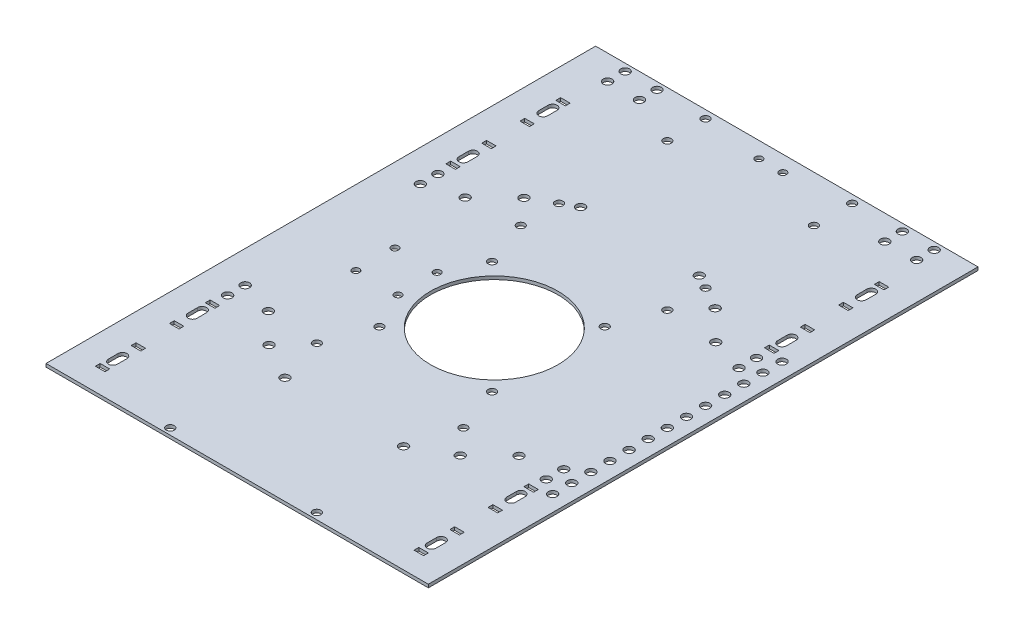
from build123d import *

# Parameters (mm, degrees)
SM_BASE_FLANGE_1_DEPTH   = 2
SKETCH_6_R               = 2.75
CUT_EXTRUDE_1_DEPTH      = 10
SKETCH_7_R               = 2.5
SKETCH_7_R_2             = 40
CUT_EXTRUDE_2_DEPTH      = 10
SKETCH_9_W               = 240
SKETCH_9_H               = 20
EXTRUDE_1_DEPTH          = 2
SKETCH_8_R               = 2.75
SKETCH_8_W               = 6
SKETCH_8_H               = 3
CUT_EXTRUDE_3_DEPTH      = 10
MIRROR_2_COPY_1_SKETCH_R = 2.75
MIRROR_2_COPY_1_SKETCH_W = 6
MIRROR_2_COPY_1_SKETCH_H = 3
MIRROR_2_COPY_1_DEPTH    = 10
SKETCH_10_R              = 2.75
CUT_EXTRUDE_4_DEPTH      = 10
SKETCH_11_R              = 2.75
CUT_EXTRUDE_5_DEPTH      = 10
SKETCH_12_R              = 2.25
CUT_EXTRUDE_6_DEPTH      = 10
SKETCH_13_R              = 2.5
CUT_EXTRUDE_7_DEPTH      = 3
SKETCH_14_R              = 2.5
CUT_EXTRUDE_8_DEPTH      = 10


# Sheet-metal steps are written as plain solids
with BuildPart() as part:
    # Sketch 1 → 基体-法兰1 (new body)
    with BuildSketch(Plane(origin=(0, 0, 0), x_dir=(1, 0, 0), z_dir=(0, 1, 0))):
        Polygon((-120, 140), (-120, -140), (120, -140), (120, 140), (120, 185), (-120, 185), align=None)
    extrude(amount=-SM_BASE_FLANGE_1_DEPTH)

    # 草图6 → 切除-拉伸1 (cut)
    with BuildSketch(Plane(origin=(0, 0, 0), x_dir=(1, 0, 0), z_dir=(0, 1, 0))):
        with Locations(Location((-60, -80, 0), (0, 0, 270))):
            Circle(SKETCH_6_R)
        with Locations(Location((-78.661073186, -61.744923397, 0), (0, 0, 270))):
            Circle(SKETCH_6_R)
        with Locations(Location((-37.250025969, -92.803208809, 0), (0, 0, 270))):
            Circle(SKETCH_6_R)
        with Locations(Location((37.250025969, -92.803208809, 0), (0, 0, 270))):
            Circle(SKETCH_6_R)
        with Locations(Location((78.661073186, -61.744923397, 0), (0, 0, 270))):
            Circle(SKETCH_6_R)
        with Locations(Location((60, -80, 0), (0, 0, 270))):
            Circle(SKETCH_6_R)
        with Locations(Location((78.661073186, 61.744923397, 0), (0, 0, 270))):
            Circle(SKETCH_6_R)
        with Locations(Location((37.250025969, 92.803208809, 0), (0, 0, 270))):
            Circle(SKETCH_6_R)
        with Locations(Location((-60, 80, 0), (0, 0, 270))):
            Circle(SKETCH_6_R)
        with Locations(Location((60, 80, 0), (0, 0, 270))):
            Circle(SKETCH_6_R)
        with Locations(Location((-78.661073186, 61.744923397, 0), (0, 0, 270))):
            Circle(SKETCH_6_R)
        with Locations(Location((-37.250025969, 92.803208809, 0), (0, 0, 270))):
            Circle(SKETCH_6_R)
    extrude(amount=-CUT_EXTRUDE_1_DEPTH, mode=Mode.SUBTRACT)

    # 草图7 → 切除-拉伸2 (cut)
    with BuildSketch(Plane(origin=(0, 0, 0), x_dir=(1, 0, 0), z_dir=(0, 1, 0))):
        with Locations(Location((-35.355339059, 35.355339059, 0), (0, 0, 270))):
            Circle(SKETCH_7_R)
        with Locations(Location((35.355339059, 35.355339059, 0), (0, 0, 270))):
            Circle(SKETCH_7_R)
        with Locations(Location((35.355339059, -35.355339059, 0), (0, 0, 270))):
            Circle(SKETCH_7_R)
        with Locations(Location((-35.355339059, -35.355339059, 0), (0, 0, 270))):
            Circle(SKETCH_7_R)
        with Locations(Location((1.384475496, 0, 0), (0, 0, 270))):
            Circle(SKETCH_7_R_2)
    extrude(amount=-CUT_EXTRUDE_2_DEPTH, mode=Mode.SUBTRACT)

    # 草图9 → 凸台-拉伸1 (add)
    with BuildSketch(Plane(origin=(0, 0, 0), x_dir=(1, 0, 0), z_dir=(0, 1, 0))):
        with Locations((0, -150)):
            Rectangle(SKETCH_9_W, SKETCH_9_H)
    extrude(amount=-EXTRUDE_1_DEPTH)

    # 草图8 → 切除-拉伸3 (cut)
    with BuildSketch(Plane(origin=(0, 0, 0), x_dir=(1, 0, 0), z_dir=(0, 1, 0))):
        with Locations(Location((100, -66, 0), (0, 0, 270))):
            Circle(SKETCH_8_R)
        with Locations(Location((100, -55, 0), (0, 0, 270))):
            Circle(SKETCH_8_R)
        with BuildLine():
            Line((102.8, -132), (102.8, -138))
            ThreePointArc((102.8, -138), (100, -140.8), (97.2, -138))
            Line((97.2, -138), (97.2, -132))
            ThreePointArc((97.2, -132), (100, -129.2), (102.8, -132))
        make_face()
        with Locations((100, -144.5)):
            Rectangle(SKETCH_8_W, SKETCH_8_H)
        with Locations((100, -122)):
            Rectangle(SKETCH_8_W, SKETCH_8_H)
        with Locations((100, -98)):
            Rectangle(SKETCH_8_W, SKETCH_8_H)
        with Locations((100, -75.5)):
            Rectangle(SKETCH_8_W, SKETCH_8_H)
        with BuildLine():
            Line((102.8, -88), (102.8, -82))
            ThreePointArc((102.8, -82), (100, -79.2), (97.2, -82))
            Line((97.2, -82), (97.2, -88))
            ThreePointArc((97.2, -88), (100, -90.8), (102.8, -88))
        make_face()
    cut_extrude_3 = extrude(amount=-CUT_EXTRUDE_3_DEPTH, mode=Mode.SUBTRACT)

    # 镜向1: 切除-拉伸3 across plane
    add(cut_extrude_3.mirror(Plane.XY), mode=Mode.SUBTRACT)

    # 镜向2: 切除-拉伸3 across plane
    add(cut_extrude_3.mirror(Plane(origin=(0, 0, 0), x_dir=(0, 0, 1), z_dir=(1, 0, 0))), mode=Mode.SUBTRACT)

    # 镜向2 copy 1 sketch → 镜向2 copy 1 (cut)
    with BuildSketch(Plane(origin=(0, 0, 0), x_dir=(-1, 0, 0), z_dir=(0, 1, 0))):
        with Locations(Location((100, -66, 0), (0, 0, 270))):
            Circle(MIRROR_2_COPY_1_SKETCH_R)
        with Locations(Location((100, -55, 0), (0, 0, 270))):
            Circle(MIRROR_2_COPY_1_SKETCH_R)
        with BuildLine():
            Line((102.8, -132), (102.8, -138))
            ThreePointArc((102.8, -138), (100, -140.8), (97.2, -138))
            Line((97.2, -138), (97.2, -132))
            ThreePointArc((97.2, -132), (100, -129.2), (102.8, -132))
        make_face()
        with Locations((100, -144.5)):
            Rectangle(MIRROR_2_COPY_1_SKETCH_W, MIRROR_2_COPY_1_SKETCH_H)
        with Locations((100, -122)):
            Rectangle(MIRROR_2_COPY_1_SKETCH_W, MIRROR_2_COPY_1_SKETCH_H)
        with Locations((100, -98)):
            Rectangle(MIRROR_2_COPY_1_SKETCH_W, MIRROR_2_COPY_1_SKETCH_H)
        with Locations((100, -75.5)):
            Rectangle(MIRROR_2_COPY_1_SKETCH_W, MIRROR_2_COPY_1_SKETCH_H)
        with BuildLine():
            Line((102.8, -88), (102.8, -82))
            ThreePointArc((102.8, -82), (100, -79.2), (97.2, -82))
            Line((97.2, -82), (97.2, -88))
            ThreePointArc((97.2, -88), (100, -90.8), (102.8, -88))
        make_face()
    extrude(amount=-MIRROR_2_COPY_1_DEPTH, mode=Mode.SUBTRACT)

    # 草图10 → 切除-拉伸4 (cut)
    with BuildSketch(Plane(origin=(0, 0, 0), x_dir=(1, 0, 0), z_dir=(0, 1, 0))):
        with Locations(Location((-97, 180.5, 0), (0, 0, 270))):
            Circle(SKETCH_10_R)
        with Locations(Location((-77, 180.5, 0), (0, 0, 270))):
            Circle(SKETCH_10_R)
        with Locations(Location((-97, 169.5, 0), (0, 0, 270))):
            Circle(SKETCH_10_R)
        with Locations(Location((-77, 169.5, 0), (0, 0, 270))):
            Circle(SKETCH_10_R)
    cut_extrude_4 = extrude(amount=-CUT_EXTRUDE_4_DEPTH, mode=Mode.SUBTRACT)

    # 镜向3: 切除-拉伸4 across plane
    add(cut_extrude_4.mirror(Plane(origin=(0, 0, 0), x_dir=(0, 0, 1), z_dir=(1, 0, 0))), mode=Mode.SUBTRACT)

    # 草图11 → 切除-拉伸5 (cut)
    with BuildSketch(Plane(origin=(0, 0, 0), x_dir=(1, 0, 0), z_dir=(0, 1, 0))):
        with Locations(Location((110, 72, 0), (0, 0, 270))):
            Circle(SKETCH_11_R)
        with Locations(Location((110, 60, 0), (0, 0, 270))):
            Circle(SKETCH_11_R)
        with Locations(Location((110, 48, 0), (0, 0, 270))):
            Circle(SKETCH_11_R)
        with Locations(Location((110, 36, 0), (0, 0, 270))):
            Circle(SKETCH_11_R)
        with Locations(Location((110, 24, 0), (0, 0, 270))):
            Circle(SKETCH_11_R)
        with Locations(Location((110, 12, 0), (0, 0, 270))):
            Circle(SKETCH_11_R)
        with Locations(Location((110, 0, 0), (0, 0, 270))):
            Circle(SKETCH_11_R)
        with Locations(Location((110, -12, 0), (0, 0, 270))):
            Circle(SKETCH_11_R)
        with Locations(Location((110, -24, 0), (0, 0, 270))):
            Circle(SKETCH_11_R)
        with Locations(Location((110, -36, 0), (0, 0, 270))):
            Circle(SKETCH_11_R)
        with Locations(Location((110, -48, 0), (0, 0, 270))):
            Circle(SKETCH_11_R)
        with Locations(Location((110, -60, 0), (0, 0, 270))):
            Circle(SKETCH_11_R)
        with Locations(Location((110, -72, 0), (0, 0, 270))):
            Circle(SKETCH_11_R)
    extrude(amount=-CUT_EXTRUDE_5_DEPTH, mode=Mode.SUBTRACT)

    # 草图12 → 切除-拉伸6 (cut)
    with BuildSketch(Plane(origin=(0, 0, 0), x_dir=(1, 0, 0), z_dir=(0, 1, 0))):
        with Locations(Location((-73.25, 12.25, 0), (0, 0, 270))):
            Circle(SKETCH_12_R)
        with Locations(Location((-73.25, -12.25, 0), (0, 0, 270))):
            Circle(SKETCH_12_R)
        with Locations(Location((-46.75, 12.25, 0), (0, 0, 270))):
            Circle(SKETCH_12_R)
        with Locations(Location((-46.75, -12.25, 0), (0, 0, 270))):
            Circle(SKETCH_12_R)
        with Locations(Location((7.5, 175, 0), (0, 0, 270))):
            Circle(SKETCH_12_R)
        with Locations(Location((-7.5, 175, 0), (0, 0, 270))):
            Circle(SKETCH_12_R)
    extrude(amount=-CUT_EXTRUDE_6_DEPTH, mode=Mode.SUBTRACT)

    # 草图13 → 切除-拉伸7 (cut)
    with BuildSketch(Plane(origin=(0, 0, 0), x_dir=(1, 0, 0), z_dir=(0, 1, 0))):
        with Locations(Location((-46, 156, 0), (0, 0, 270))):
            Circle(SKETCH_13_R)
        with Locations(Location((-46, 64, 0), (0, 0, 270))):
            Circle(SKETCH_13_R)
        with Locations(Location((46, 64, 0), (0, 0, 270))):
            Circle(SKETCH_13_R)
        with Locations(Location((46, 156, 0), (0, 0, 270))):
            Circle(SKETCH_13_R)
    cut_extrude_7 = extrude(amount=-CUT_EXTRUDE_7_DEPTH, mode=Mode.SUBTRACT)

    # 镜向4: 切除-拉伸7 across plane
    add(cut_extrude_7.mirror(Plane.XY), mode=Mode.SUBTRACT)

    # 草图14 → 切除-拉伸8 (cut)
    with BuildSketch(Plane(origin=(0, 0, 0), x_dir=(1, 0, 0), z_dir=(0, 1, 0))):
        with Locations(Location((-46, 180, 0), (0, 0, 270))):
            Circle(SKETCH_14_R)
        with Locations(Location((-46, 88, 0), (0, 0, 270))):
            Circle(SKETCH_14_R)
        with Locations(Location((46, 88, 0), (0, 0, 270))):
            Circle(SKETCH_14_R)
        with Locations(Location((46, 180, 0), (0, 0, 270))):
            Circle(SKETCH_14_R)
    extrude(amount=-CUT_EXTRUDE_8_DEPTH, mode=Mode.SUBTRACT)


solid = part.part
